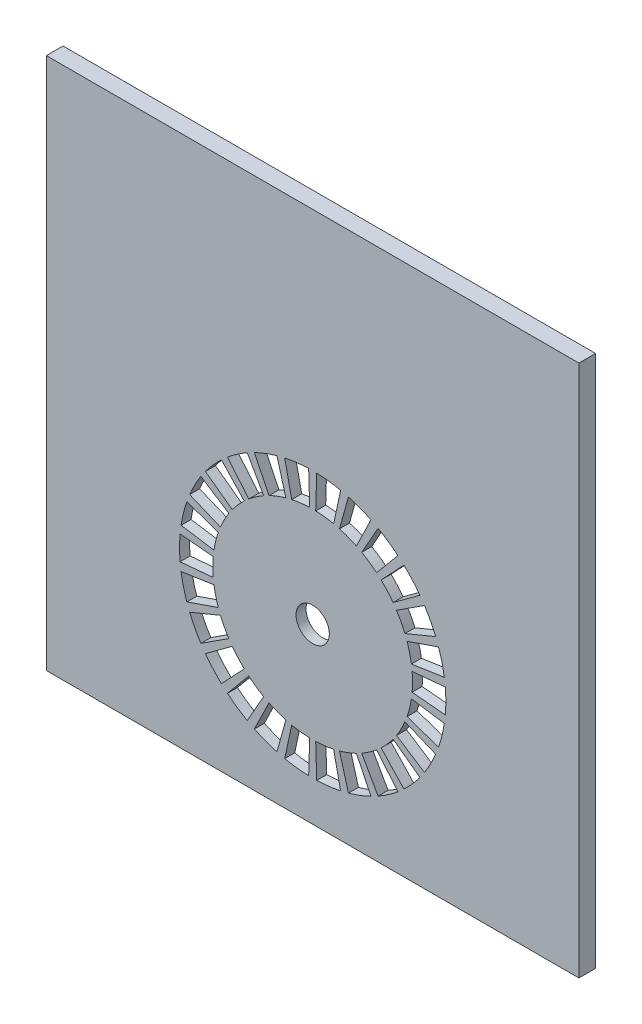
from build123d import *

# Parameters (mm, degrees)
LED_PANEL_W                      = 80
LED_PANEL_H                      = 80
EXTRUDE_LED_PANEL_DEPTH          = 2.5
SKETCH1_R                        = 2.5
CUT_ARROW_INDICATION_HOLES_DEPTH = 57.623758265
CUT_EXTRUDE2_DEPTH               = 1


with BuildPart() as part:
    # LED panel → Extrude LED panel (new body)
    with BuildSketch(Plane.XY):
        Rectangle(LED_PANEL_W, LED_PANEL_H)
    extrude(amount=EXTRUDE_LED_PANEL_DEPTH)

    # Sketch1 → Cut arrow indication holes (cut, through all)
    with BuildSketch(Plane.XY.offset(2.5)):
        with Locations((0, -14)):
            Circle(SKETCH1_R)
        with BuildLine():
            Line((14.938448364, -12.642516863), (19.917931152, -12.190022483))
            ThreePointArc((19.917931152, -12.190022483), (20, -14), (19.917931152, -15.809977517))
            Line((19.917931152, -15.809977517), (14.938448364, -15.357483137))
            ThreePointArc((14.938448364, -15.357483137), (15, -14), (14.938448364, -12.642516863))
        make_face()
        with BuildLine():
            Line((14.829231183, -16.256967549), (19.772308244, -17.009290065))
            ThreePointArc((19.772308244, -17.009290065), (19.418836349, -18.786313286), (18.905996301, -20.524055784))
            Line((18.905996301, -20.524055784), (14.179497226, -18.893041838))
            ThreePointArc((14.179497226, -18.893041838), (14.564127261, -17.589734964), (14.829231183, -16.256967549))
        make_face()
        with BuildLine():
            Line((13.858192988, -19.740251485), (18.47759065, -21.653668647))
            ThreePointArc((18.47759065, -21.653668647), (17.709120513, -23.294463441), (16.795313665, -24.858979644))
            Line((16.795313665, -24.858979644), (12.596485248, -22.144234733))
            ThreePointArc((12.596485248, -22.144234733), (13.281840385, -20.970847581), (13.858192988, -19.740251485))
        make_face()
        with BuildLine():
            Line((12.081766988, -22.88993287), (16.109022651, -25.853243827))
            ThreePointArc((16.109022651, -25.853243827), (14.970214963, -27.262453165), (13.708548447, -28.562819078))
            Line((13.708548447, -28.562819078), (10.281411335, -24.922114308))
            ThreePointArc((10.281411335, -24.922114308), (11.227661223, -23.946839874), (12.081766988, -22.88993287))
        make_face()
        with BuildLine():
            Line((9.603192607, -25.522963671), (12.804256809, -29.363951561))
            ThreePointArc((12.804256809, -29.363951561), (11.361294935, -30.459677318), (9.825092222, -31.4203204))
            Line((9.825092222, -31.4203204), (7.368819166, -27.0652403))
            ThreePointArc((7.368819166, -27.0652403), (8.520971201, -26.344757988), (9.603192607, -25.522963671))
        make_face()
        with BuildLine():
            Line((6.566515577, -27.486321706), (8.755354103, -31.981762275))
            ThreePointArc((8.755354103, -31.981762275), (7.092097741, -32.700324854), (5.370637349, -33.265416021))
            Line((5.370637349, -33.265416021), (4.027978012, -28.449062016))
            ThreePointArc((4.027978012, -28.449062016), (5.319073306, -28.02524364), (6.566515577, -27.486321706))
        make_face()
        with BuildLine():
            Line((3.148216531, -28.665903746), (4.197622041, -33.554538327))
            ThreePointArc((4.197622041, -33.554538327), (2.410733605, -33.854177482), (0.604060556, -33.99087569))
            Line((0.604060556, -33.99087569), (0.453045417, -28.993156767))
            ThreePointArc((0.453045417, -28.993156767), (1.808050204, -28.890633111), (3.148216531, -28.665903746))
        make_face()
        with BuildLine():
            Line((-0.453045417, -28.993156767), (-0.604060556, -33.99087569))
            ThreePointArc((-0.604060556, -33.99087569), (-2.410733605, -33.854177482), (-4.197622041, -33.554538327))
            Line((-4.197622041, -33.554538327), (-3.148216531, -28.665903746))
            ThreePointArc((-3.148216531, -28.665903746), (-1.808050204, -28.890633111), (-0.453045417, -28.993156767))
        make_face()
        with BuildLine():
            Line((-4.027978012, -28.449062016), (-5.370637349, -33.265416021))
            ThreePointArc((-5.370637349, -33.265416021), (-7.092097741, -32.700324854), (-8.755354103, -31.981762275))
            Line((-8.755354103, -31.981762275), (-6.566515577, -27.486321706))
            ThreePointArc((-6.566515577, -27.486321706), (-5.319073306, -28.02524364), (-4.027978012, -28.449062016))
        make_face()
        with BuildLine():
            Line((-7.368819166, -27.0652403), (-9.825092222, -31.4203204))
            ThreePointArc((-9.825092222, -31.4203204), (-11.361294935, -30.459677318), (-12.804256809, -29.363951561))
            Line((-12.804256809, -29.363951561), (-9.603192607, -25.522963671))
            ThreePointArc((-9.603192607, -25.522963671), (-8.520971201, -26.344757988), (-7.368819166, -27.0652403))
        make_face()
        with BuildLine():
            Line((-10.281411335, -24.922114308), (-13.708548447, -28.562819078))
            ThreePointArc((-13.708548447, -28.562819078), (-14.970214963, -27.262453165), (-16.109022651, -25.853243827))
            Line((-16.109022651, -25.853243827), (-12.081766988, -22.88993287))
            ThreePointArc((-12.081766988, -22.88993287), (-11.227661223, -23.946839874), (-10.281411335, -24.922114308))
        make_face()
        with BuildLine():
            Line((-12.596485248, -22.144234733), (-16.795313665, -24.858979644))
            ThreePointArc((-16.795313665, -24.858979644), (-17.709120513, -23.294463441), (-18.47759065, -21.653668647))
            Line((-18.47759065, -21.653668647), (-13.858192988, -19.740251485))
            ThreePointArc((-13.858192988, -19.740251485), (-13.281840385, -20.970847581), (-12.596485248, -22.144234733))
        make_face()
        with BuildLine():
            Line((-14.179497226, -18.893041838), (-18.905996301, -20.524055784))
            ThreePointArc((-18.905996301, -20.524055784), (-19.418836349, -18.786313286), (-19.772308244, -17.009290065))
            Line((-19.772308244, -17.009290065), (-14.829231183, -16.256967549))
            ThreePointArc((-14.829231183, -16.256967549), (-14.564127261, -17.589734964), (-14.179497226, -18.893041838))
        make_face()
        with BuildLine():
            Line((-14.938448364, -15.357483137), (-19.917931152, -15.809977517))
            ThreePointArc((-19.917931152, -15.809977517), (-20, -14), (-19.917931152, -12.190022483))
            Line((-19.917931152, -12.190022483), (-14.938448364, -12.642516863))
            ThreePointArc((-14.938448364, -12.642516863), (-15, -14), (-14.938448364, -15.357483137))
        make_face()
        with BuildLine():
            Line((-14.829231183, -11.743032451), (-19.772308244, -10.990709935))
            ThreePointArc((-19.772308244, -10.990709935), (-19.418836349, -9.213686714), (-18.905996301, -7.475944216))
            Line((-18.905996301, -7.475944216), (-14.179497226, -9.106958162))
            ThreePointArc((-14.179497226, -9.106958162), (-14.564127261, -10.410265036), (-14.829231183, -11.743032451))
        make_face()
        with BuildLine():
            Line((-13.858192988, -8.259748515), (-18.47759065, -6.346331353))
            ThreePointArc((-18.47759065, -6.346331353), (-17.709120513, -4.705536559), (-16.795313665, -3.141020356))
            Line((-16.795313665, -3.141020356), (-12.596485248, -5.855765267))
            ThreePointArc((-12.596485248, -5.855765267), (-13.281840385, -7.029152419), (-13.858192988, -8.259748515))
        make_face()
        with BuildLine():
            Line((-12.081766988, -5.11006713), (-16.109022651, -2.146756173))
            ThreePointArc((-16.109022651, -2.146756173), (-14.970214963, -0.737546835), (-13.708548447, 0.562819078))
            Line((-13.708548447, 0.562819078), (-10.281411335, -3.077885692))
            ThreePointArc((-10.281411335, -3.077885692), (-11.227661223, -4.053160126), (-12.081766988, -5.11006713))
        make_face()
        with BuildLine():
            Line((-9.603192607, -2.477036329), (-12.804256809, 1.363951561))
            ThreePointArc((-12.804256809, 1.363951561), (-11.361294935, 2.459677318), (-9.825092222, 3.4203204))
            Line((-9.825092222, 3.4203204), (-7.368819166, -0.9347597))
            ThreePointArc((-7.368819166, -0.9347597), (-8.520971201, -1.655242012), (-9.603192607, -2.477036329))
        make_face()
        with BuildLine():
            Line((-6.566515577, -0.513678294), (-8.755354103, 3.981762275))
            ThreePointArc((-8.755354103, 3.981762275), (-7.092097741, 4.700324854), (-5.370637349, 5.265416021))
            Line((-5.370637349, 5.265416021), (-4.027978012, 0.449062016))
            ThreePointArc((-4.027978012, 0.449062016), (-5.319073306, 0.02524364), (-6.566515577, -0.513678294))
        make_face()
        with BuildLine():
            Line((-3.148216531, 0.665903746), (-4.197622041, 5.554538327))
            ThreePointArc((-4.197622041, 5.554538327), (-2.410733605, 5.854177482), (-0.604060556, 5.99087569))
            Line((-0.604060556, 5.99087569), (-0.453045417, 0.993156767))
            ThreePointArc((-0.453045417, 0.993156767), (-1.808050204, 0.890633111), (-3.148216531, 0.665903746))
        make_face()
        with BuildLine():
            Line((0.453045417, 0.993156767), (0.604060556, 5.99087569))
            ThreePointArc((0.604060556, 5.99087569), (2.410733605, 5.854177482), (4.197622041, 5.554538327))
            Line((4.197622041, 5.554538327), (3.148216531, 0.665903746))
            ThreePointArc((3.148216531, 0.665903746), (1.808050204, 0.890633111), (0.453045417, 0.993156767))
        make_face()
        with BuildLine():
            Line((4.027978012, 0.449062016), (5.370637349, 5.265416021))
            ThreePointArc((5.370637349, 5.265416021), (7.092097741, 4.700324854), (8.755354103, 3.981762275))
            Line((8.755354103, 3.981762275), (6.566515577, -0.513678294))
            ThreePointArc((6.566515577, -0.513678294), (5.319073306, 0.02524364), (4.027978012, 0.449062016))
        make_face()
        with BuildLine():
            Line((7.368819166, -0.9347597), (9.825092222, 3.4203204))
            ThreePointArc((9.825092222, 3.4203204), (11.361294935, 2.459677318), (12.804256809, 1.363951561))
            Line((12.804256809, 1.363951561), (9.603192607, -2.477036329))
            ThreePointArc((9.603192607, -2.477036329), (8.520971201, -1.655242012), (7.368819166, -0.9347597))
        make_face()
        with BuildLine():
            Line((10.281411335, -3.077885692), (13.708548447, 0.562819078))
            ThreePointArc((13.708548447, 0.562819078), (14.970214963, -0.737546835), (16.109022651, -2.146756173))
            Line((16.109022651, -2.146756173), (12.081766988, -5.11006713))
            ThreePointArc((12.081766988, -5.11006713), (11.227661223, -4.053160126), (10.281411335, -3.077885692))
        make_face()
        with BuildLine():
            Line((12.596485248, -5.855765267), (16.795313665, -3.141020356))
            ThreePointArc((16.795313665, -3.141020356), (17.709120513, -4.705536559), (18.47759065, -6.346331353))
            Line((18.47759065, -6.346331353), (13.858192988, -8.259748515))
            ThreePointArc((13.858192988, -8.259748515), (13.281840385, -7.029152419), (12.596485248, -5.855765267))
        make_face()
        with BuildLine():
            Line((14.179497226, -9.106958162), (18.905996301, -7.475944216))
            ThreePointArc((18.905996301, -7.475944216), (19.418836349, -9.213686714), (19.772308244, -10.990709935))
            Line((19.772308244, -10.990709935), (14.829231183, -11.743032451))
            ThreePointArc((14.829231183, -11.743032451), (14.564127261, -10.410265036), (14.179497226, -9.106958162))
        make_face()
    extrude(amount=-CUT_ARROW_INDICATION_HOLES_DEPTH, mode=Mode.SUBTRACT)

    # Sketch2 → Cut-Extrude2 (cut)
    with BuildSketch(Plane(origin=(0, 0, 0), x_dir=(-1, 0, 0), z_dir=(0, 0, -1))):
        with BuildLine():
            Line((-1, 13.481812167), (-1, 14.981812167))
            Line((-1, 14.981812167), (1, 14.981812167))
            Line((1, 14.981812167), (1, 13.481812167))
            ThreePointArc((1, 13.481812167), (27.200508752, -9.952491679), (8.958236434, -40))
            Line((8.958236434, -40), (-8.958236434, -40))
            ThreePointArc((-8.958236434, -40), (-27.200508752, -9.952491679), (-1, 13.481812167))
        make_face()
    extrude(amount=-CUT_EXTRUDE2_DEPTH, mode=Mode.SUBTRACT)


solid = part.part
